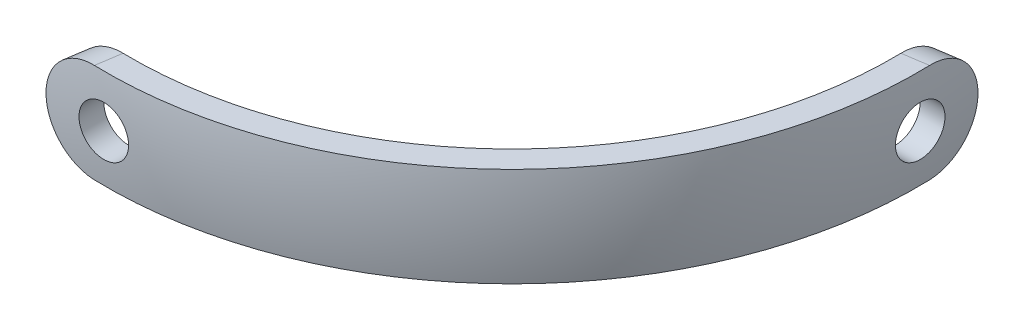
from build123d import *

# Parameters (mm, degrees)
REVOLVE_1_ANGLE           = 98.68117871
REVOLVE_1_OTHER_WAY_ANGLE = 8.68117871
SKETCH_3_R                = 4
CUT_EXTRUDE_1_DEPTH       = 94.680307429
SKETCH_4_R                = 4
CUT_EXTRUDE_2_DEPTH       = 94.59487173
FILLET_START              = -16.507933569
FILLET_1_DEPTH            = 83.507933569
FILLET_START_2            = -67
FILLET_1_2_DEPTH          = 83.255659247


with BuildPart() as part:
    # 草图2 → 旋转1 (revolve)
    with BuildSketch(Plane.XY):
        with BuildLine():
            Line((61.481704596, 8), (65.513357417, 8))
            ThreePointArc((65.513357417, 8), (66, 0), (65.513357417, -8))
            Line((65.513357417, -8), (61.481704596, -8))
            ThreePointArc((61.481704596, -8), (62, 0), (61.481704596, 8))
        make_face()
    revolve(axis=Axis((0, 0, 0), (0, -1, 0)), revolution_arc=REVOLVE_1_ANGLE)

    # 草图2 → 旋转1 other way (revolve)
    with BuildSketch(Plane.XY):
        with BuildLine():
            Line((61.481704596, 8), (65.513357417, 8))
            ThreePointArc((65.513357417, 8), (66, 0), (65.513357417, -8))
            Line((65.513357417, -8), (61.481704596, -8))
            ThreePointArc((61.481704596, -8), (62, 0), (61.481704596, 8))
        make_face()
    revolve(axis=Axis((0, 0, 0), (0, 1, 0)), revolution_arc=REVOLVE_1_OTHER_WAY_ANGLE)

    # 草图3 → 切除-拉伸1 (cut, through all)
    with BuildSketch(Plane.XY):
        with Locations(Location((0, 0, 0), (0, 0, 180))):
            Circle(SKETCH_3_R)
    extrude(amount=CUT_EXTRUDE_1_DEPTH, mode=Mode.SUBTRACT)

    # 草图4 → 切除-拉伸2 (cut, through all)
    with BuildSketch(Plane(origin=(0, 0, 0), x_dir=(0, 0, -1), z_dir=(1, 0, 0))):
        with Locations(Location((0, 0, 0), (0, 0, 180))):
            Circle(SKETCH_4_R)
    extrude(amount=CUT_EXTRUDE_2_DEPTH, mode=Mode.SUBTRACT)

    # 圆角1: read off the stored shape, not the designer's step
    # 圆角1 outline → 圆角1 (cut)
    with BuildSketch(Plane(origin=(0, 0, 0), x_dir=(0, 1, 0), z_dir=(0.9885435216678343, 0, -0.15093609829512605)).offset(FILLET_START)):
        with BuildLine():
            Line((8, 0), (8, 8))
            ThreePointArc((8, 8), (5.656854249, 2.343145751), (0, 0))
            Line((0, 0), (8, 0))
        make_face()
        with BuildLine():
            Line((-8, 0), (0, 0))
            ThreePointArc((0, 0), (-5.656854249, 2.343145751), (-8, 8))
            Line((-8, 8), (-8, 0))
        make_face()
    extrude(amount=FILLET_1_DEPTH, mode=Mode.SUBTRACT)

    # Fillet 1 2 outline → Fillet 1 2 (cut)
    with BuildSketch(Plane(origin=(0, 0, 0), x_dir=(0.9885435216678338, 0, 0.15093609829512997), z_dir=(0.15093609829512997, 0, -0.9885435216678338)).offset(FILLET_START_2)):
        with BuildLine():
            Line((0, -8), (8, -8))
            ThreePointArc((8, -8), (2.343145751, -5.656854249), (0, 0))
            Line((0, 0), (0, -8))
        make_face()
        with BuildLine():
            Line((0, 8), (0, 0))
            ThreePointArc((0, 0), (2.343145751, 5.656854249), (8, 8))
            Line((8, 8), (0, 8))
        make_face()
    extrude(amount=FILLET_1_2_DEPTH, mode=Mode.SUBTRACT)


solid = part.part
